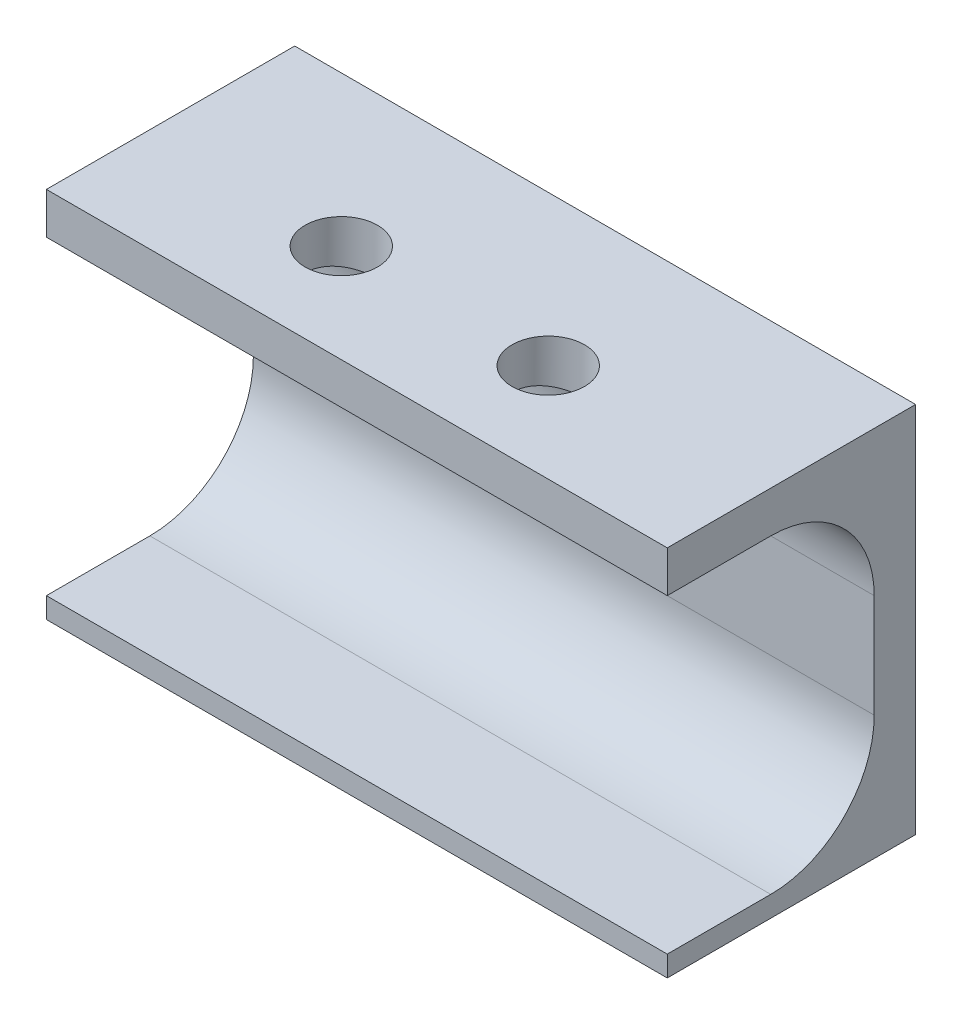
from build123d import *

# Parameters (mm, degrees)
BOSS_EXTRUDE1_DEPTH = 30
SKETCH2_R           = 1.75
CUT_EXTRUDE1_DEPTH  = 5


with BuildPart() as part:
    # Sketch1 → Boss-Extrude1 (new body)
    with BuildSketch(Plane(origin=(0, 0, 0), x_dir=(0, 0, -1), z_dir=(1, 0, 0))):
        with BuildLine():
            Line((-6.539148929, 14.609586507), (-11.539148929, 14.609586507))
            Line((-11.539148929, 14.609586507), (-11.539148929, 16.609586507))
            Line((-11.539148929, 16.609586507), (0.460851071, 16.609586507))
            Line((0.460851071, 16.609586507), (0.460851071, -1.390413493))
            Line((0.460851071, -1.390413493), (-11.539148929, -1.390413493))
            Line((-11.539148929, -1.390413493), (-11.539148929, -0.390413493))
            Line((-11.539148929, -0.390413493), (-8.539148929, -0.390413493))
            Line((-8.539148929, -0.390413493), (-6.539148929, -0.390413493))
            ThreePointArc((-6.539148929, -0.390413493), (-3.003615023, 1.074052601), (-1.539148929, 4.609586507))
            Line((-1.539148929, 4.609586507), (-1.539148929, 9.609586507))
            ThreePointArc((-1.539148929, 9.609586507), (-3.003615023, 13.145120413), (-6.539148929, 14.609586507))
        make_face()
    extrude(amount=BOSS_EXTRUDE1_DEPTH)

    # Sketch2 → Cut-Extrude1 (cut)
    with BuildSketch(Plane(origin=(0, 16.609586507, 0), x_dir=(1, 0, 0), z_dir=(0, 1, 0))):
        with Locations((-10.5, -6.789148929)):
            Circle(SKETCH2_R)
        with Locations((-20.5, -6.789148929)):
            Circle(SKETCH2_R)
        with Locations((9.5, -6.789148929)):
            Circle(SKETCH2_R)
        with Locations((19.5, -6.789148929)):
            Circle(SKETCH2_R)
    extrude(amount=-CUT_EXTRUDE1_DEPTH, mode=Mode.SUBTRACT)


solid = part.part
